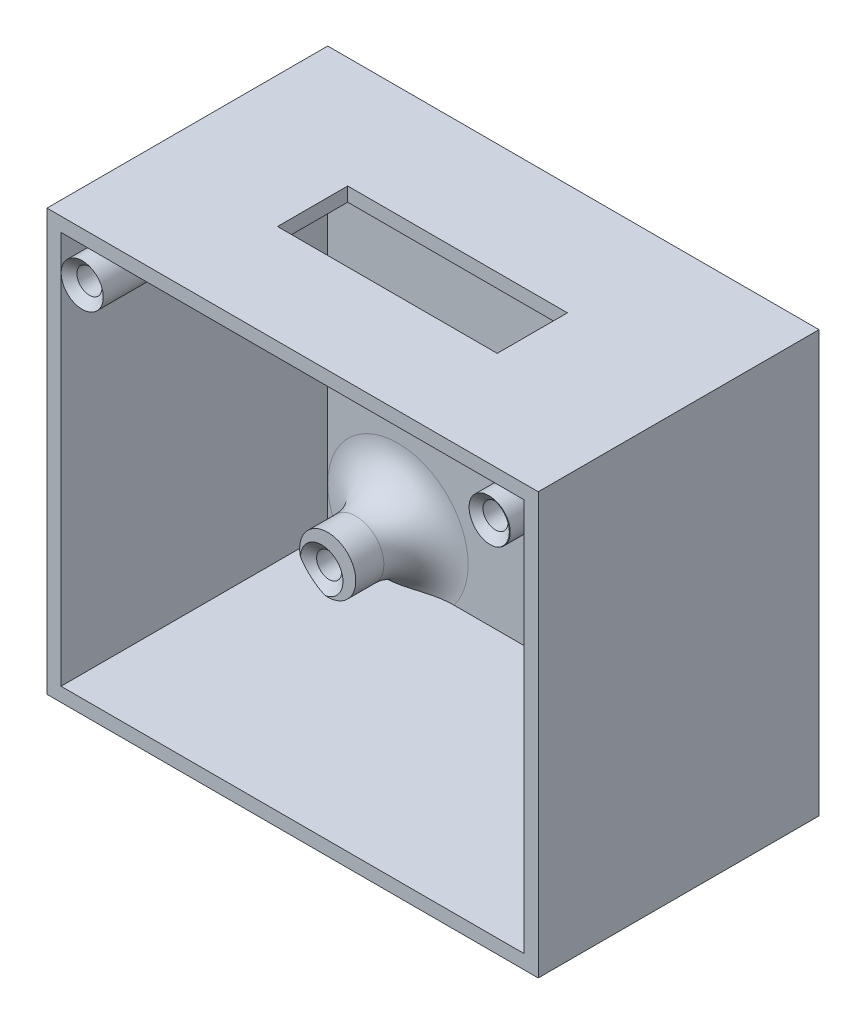
from build123d import *

# Parameters (mm, degrees)
SKETCH1_W                                         = 35
SKETCH1_H                                         = 30
BOSS_EXTRUDE1_DEPTH                               = 20
SHELL1_T                                          = -1
SKETCH6_R                                         = 2
BOSS_EXTRUDE5_DEPTH                               = 5
CSK_FOR_0_FLAT_HEAD_MACHINE_SCREW_100_D           = 1.778
CSK_FOR_0_FLAT_HEAD_MACHINE_SCREW_100_CSINK_D     = 3.0226
CSK_FOR_0_FLAT_HEAD_MACHINE_SCREW_100_CSINK_ANGLE = 100
SKETCH11_R                                        = 1.5
BOSS_EXTRUDE6_DEPTH                               = 19.5
CSK_FOR_0_FLAT_HEAD_MACHINE_SCREW_2_D             = 1.778
CSK_FOR_0_FLAT_HEAD_MACHINE_SCREW_2_CSINK_D       = 3.0226
CSK_FOR_0_FLAT_HEAD_MACHINE_SCREW_2_CSINK_ANGLE   = 100
SKETCH16_W                                        = 15.652105204
SKETCH16_H                                        = 5
CUT_EXTRUDE1_DEPTH                                = 7.5
FILLET1_R                                         = 3
FILLET2_R                                         = 3


with BuildPart() as part:
    # Sketch1 → Boss-Extrude1 (new body)
    with BuildSketch(Plane.XY):
        with Locations((17.5, 15)):
            Rectangle(SKETCH1_W, SKETCH1_H)
    extrude(amount=BOSS_EXTRUDE1_DEPTH)

    # Shell1
    shell1_openings = [part.faces().sort_by_distance(p)[0] for p in [
        (17.5, 15, 20),
    ]]
    offset(amount=SHELL1_T, openings=shell1_openings, kind=Kind.INTERSECTION)

    # Sketch6 → Boss-Extrude5 (add)
    with BuildSketch(Plane.XY.offset(1)):
        with Locations(Location((31, 4, 0), (0, 0, 180))):
            Circle(SKETCH6_R)
        with Locations(Location((6, 4, 0), (0, 0, 180))):
            Circle(SKETCH6_R)
    extrude(amount=BOSS_EXTRUDE5_DEPTH)

    # CSK for _0 Flat Head Machine Screw _100 (through all)
    with Locations(Plane.XY.offset(6)):
        with Locations((5.574399883, 3.50151513), (31, 4)):
            CounterSinkHole(CSK_FOR_0_FLAT_HEAD_MACHINE_SCREW_100_D / 2, CSK_FOR_0_FLAT_HEAD_MACHINE_SCREW_100_CSINK_D / 2, counter_sink_angle=CSK_FOR_0_FLAT_HEAD_MACHINE_SCREW_100_CSINK_ANGLE)

    # Sketch11 → Boss-Extrude6 (add)
    with BuildSketch(Plane.XY.offset(1)):
        with Locations(Location((3, 27, 0), (0, 0, 180))):
            Circle(SKETCH11_R)
        with Locations(Location((32, 27, 0), (0, 0, 180))):
            Circle(SKETCH11_R)
    extrude(amount=BOSS_EXTRUDE6_DEPTH)

    # CSK for _0 Flat Head Machine Screw _ 2 (through all)
    with Locations(Plane.XY.offset(20.5)):
        with Locations((31.925463408, 26.981922801), (3, 27)):
            CounterSinkHole(CSK_FOR_0_FLAT_HEAD_MACHINE_SCREW_2_D / 2, CSK_FOR_0_FLAT_HEAD_MACHINE_SCREW_2_CSINK_D / 2, counter_sink_angle=CSK_FOR_0_FLAT_HEAD_MACHINE_SCREW_2_CSINK_ANGLE)

    # Sketch16 → Cut-Extrude1 (cut)
    with BuildSketch(Plane(origin=(0, 30, 0), x_dir=(1, 0, 0), z_dir=(0, 1, 0))):
        with Locations((17.173947398, -10.424136078)):
            Rectangle(SKETCH16_W, SKETCH16_H)
    extrude(amount=-CUT_EXTRUDE1_DEPTH, mode=Mode.SUBTRACT)

    # Fillet1
    # the kernel refuses this fillet: 3 mm, written as the material it adds along each edge
    with BuildSketch(Plane(origin=(3, 27, 1), x_dir=(-1, 0, 0), z_dir=(0, 1, 0))) as fillet1_piece_1_section:
        with BuildLine():
            CenterArc((1.5 + FILLET1_R, FILLET1_R), FILLET1_R, 180, 90)
            Line((1.5, FILLET1_R), (1.5, 0))
            Line((1.5, 0), (1.5 + FILLET1_R, 0))
        make_face()
    fillet1_piece_1 = revolve(axis=Axis((3, 27, 1), (0, 0, 1)), mode=Mode.PRIVATE)
    fillet1_piece_1 = split(fillet1_piece_1, bisect_by=Plane(origin=(1, 27, 1.859549256), z_dir=(1, 0, 0)), keep=Keep.TOP, mode=Mode.PRIVATE)
    fillet1_piece_1 = split(fillet1_piece_1, bisect_by=Plane(origin=(5.359549256, 29, 1.859549256), z_dir=(0, -1, 0)), keep=Keep.TOP, mode=Mode.PRIVATE)
    add(fillet1_piece_1)
    with BuildSketch(Plane(origin=(32, 27, 1), x_dir=(-1, 0, 0), z_dir=(0, 1, 0))) as fillet1_piece_2_section:
        with BuildLine():
            CenterArc((1.5 + FILLET1_R, FILLET1_R), FILLET1_R, 180, 90)
            Line((1.5, FILLET1_R), (1.5, 0))
            Line((1.5, 0), (1.5 + FILLET1_R, 0))
        make_face()
    fillet1_piece_2 = revolve(axis=Axis((32, 27, 1), (0, 0, 1)), mode=Mode.PRIVATE)
    fillet1_piece_2 = split(fillet1_piece_2, bisect_by=Plane(origin=(30.141729678, 29, 1.076089877), z_dir=(0, -1, 0)), keep=Keep.TOP, mode=Mode.PRIVATE)
    fillet1_piece_2 = split(fillet1_piece_2, bisect_by=Plane(origin=(34, 23.781381388, 1.076089877), z_dir=(-1, 0, 0)), keep=Keep.TOP, mode=Mode.PRIVATE)
    add(fillet1_piece_2)

    # Fillet2
    # the kernel refuses this fillet: 3 mm, written as the material it adds along each edge
    with BuildSketch(Plane(origin=(31, 4, 1), x_dir=(-1, 0, 0), z_dir=(0, 1, 0))) as fillet2_piece_1_section:
        with BuildLine():
            CenterArc((2 + FILLET2_R, FILLET2_R), FILLET2_R, 180, 90)
            Line((2, FILLET2_R), (2, 0))
            Line((2, 0), (2 + FILLET2_R, 0))
        make_face()
    fillet2_piece_1 = revolve(axis=Axis((31, 4, 1), (0, 0, 1)), mode=Mode.PRIVATE)
    fillet2_piece_1 = split(fillet2_piece_1, bisect_by=Plane(origin=(33.856939256, 0, 1.856939256), z_dir=(0, 1, 0)), keep=Keep.TOP, mode=Mode.PRIVATE)
    fillet2_piece_1 = split(fillet2_piece_1, bisect_by=Plane(origin=(35, 4, 1.856939256), z_dir=(-1, 0, 0)), keep=Keep.TOP, mode=Mode.PRIVATE)
    add(fillet2_piece_1)
    with BuildSketch(Plane(origin=(6, 4, 1), x_dir=(-1, 0, 0), z_dir=(0, 1, 0))) as fillet2_piece_2_section:
        with BuildLine():
            CenterArc((2 + FILLET2_R, FILLET2_R), FILLET2_R, 180, 90)
            Line((2, FILLET2_R), (2, 0))
            Line((2, 0), (2 + FILLET2_R, 0))
        make_face()
    fillet2_piece_2 = revolve(axis=Axis((6, 4, 1), (0, 0, 1)), mode=Mode.PRIVATE)
    fillet2_piece_2 = split(fillet2_piece_2, bisect_by=Plane(origin=(8.856531723, 0, 1.856531723), z_dir=(0, 1, 0)), keep=Keep.TOP, mode=Mode.PRIVATE)
    add(fillet2_piece_2)


solid = part.part
